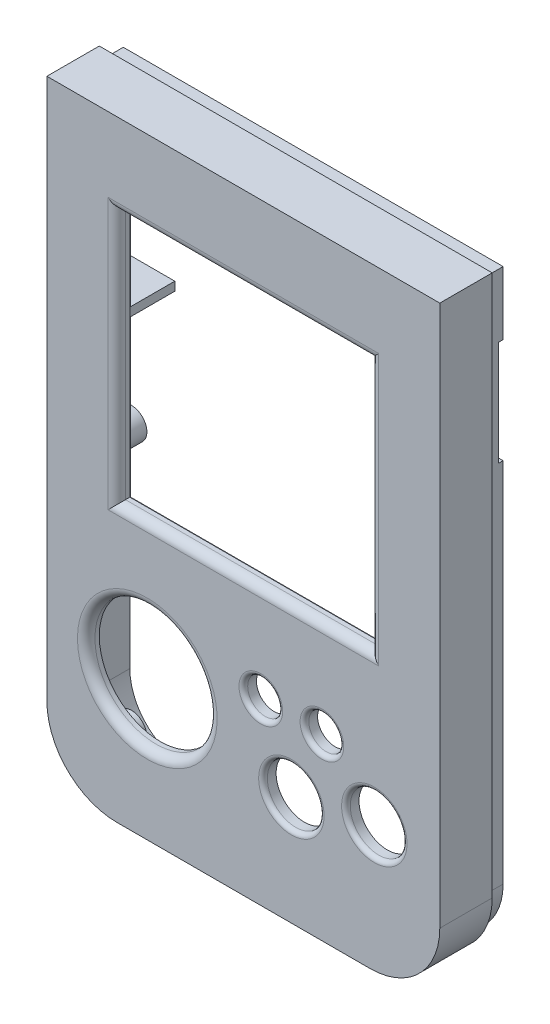
from build123d import *

# Parameters (mm, degrees)
EXTRUDE_1_DEPTH     = 8
SHELL_2_T           = -1.5
SKETCH_4_R          = 7
SKETCH_4_R_2        = 3.25
SKETCH_4_R_3        = 2
SKETCH_4_W          = 29
SKETCH_4_H          = 29
CUT_EXTRUDE_3_DEPTH = 84.600239234
FILLET_1_R          = 1
FILLET_2_R          = 1
FILLET_3_R          = 0.5
SKETCH_5_W          = 33.7
SKETCH_5_H          = 37.6
SKETCH_5_W_2        = 31.7
SKETCH_5_H_2        = 35.6
EXTRUDE_2_DEPTH     = 1.4
SKETCH_6_R          = 1.75
SKETCH_6_R_2        = 0.75
EXTRUDE_3_DEPTH     = 3.7
CUT_EXTRUDE_4_DEPTH = 2
SKETCH_8_W          = 0.75
SKETCH_8_H          = 12
CUT_EXTRUDE_5_DEPTH = 0.5
SKETCH_9_W          = 5.15
SKETCH_9_H          = 1
EXTRUDE_4_DEPTH     = 6.5


with BuildPart() as part:
    # 草图1 → 凸台-拉伸1 (new body)
    with BuildSketch(Plane.XY):
        with BuildLine():
            Line((-45, 70), (0, 70))
            Line((0, 70), (0, 8))
            ThreePointArc((0, 8), (-2.343145751, 2.343145751), (-8, 0))
            Line((-8, 0), (-37, 0))
            ThreePointArc((-37, 0), (-42.656854249, 2.343145751), (-45, 8))
            Line((-45, 8), (-45, 70))
        make_face()
    extrude(amount=EXTRUDE_1_DEPTH)

    # 抽壳2
    shell_2_openings = [part.faces().sort_by_distance(p)[0] for p in [
        (-22.5, 35.292176643, 0),
    ]]
    offset(amount=SHELL_2_T, openings=shell_2_openings, kind=Kind.INTERSECTION)

    # 草图4 → 切除-拉伸3 (cut, through all)
    with BuildSketch(Plane(origin=(0, 0, 0), x_dir=(-1, 0, 0), z_dir=(0, 0, -1))):
        with Locations((33.5, 16)):
            Circle(SKETCH_4_R)
        with Locations((7.5, 14.5)):
            Circle(SKETCH_4_R_2)
        with Locations((17, 12.5)):
            Circle(SKETCH_4_R_2)
        with Locations((13.5, 20.5)):
            Circle(SKETCH_4_R_3)
        with Locations((20.5, 20.5)):
            Circle(SKETCH_4_R_3)
        with Locations((22.5, 46)):
            Rectangle(SKETCH_4_W, SKETCH_4_H)
    extrude(amount=-CUT_EXTRUDE_3_DEPTH, mode=Mode.SUBTRACT)

    # 圆角1
    fillet_1_edges = [part.edges().sort_by_distance(p)[0] for p in [
        (-22.5, 60.5, 8),
        (-8, 46, 8),
        (-22.5, 31.5, 8),
        (-37, 46, 8),
    ]]
    fillet(fillet_1_edges, radius=FILLET_1_R)

    # 圆角2
    fillet_2_edges = [part.edges().sort_by_distance(p)[0] for p in [
        (-26.5, 16, 8),
    ]]
    fillet(fillet_2_edges, radius=FILLET_2_R)

    # 圆角3
    fillet_3_edges = [part.edges().sort_by_distance(p)[0] for p in [
        (-11.5, 20.5, 8),
        (-18.5, 20.5, 8),
        (-4.25, 14.5, 8),
        (-13.75, 12.5, 8),
    ]]
    fillet(fillet_3_edges, radius=FILLET_3_R)

    # 草图5 → 凸台-拉伸2 (add)
    with BuildSketch(Plane(origin=(0, 0, 6.5), x_dir=(-1, 0, 0), z_dir=(0, 0, -1))):
        with Locations((22.5, 47.95)):
            Rectangle(SKETCH_5_W, SKETCH_5_H)
        with Locations((22.5, 47.95)):
            Rectangle(SKETCH_5_W_2, SKETCH_5_H_2, mode=Mode.SUBTRACT)
    extrude(amount=EXTRUDE_2_DEPTH)

    # 草图6 → 凸台-拉伸3 (add)
    # profile 1 of 6: a face of its own
    with BuildSketch(Plane(origin=(0, 0, 6.5), x_dir=(-1, 0, 0), z_dir=(0, 0, -1))):
        with Locations((4.5, 65.5)):
            Circle(SKETCH_6_R)
        with Locations((4.5, 65.5)):
            Circle(SKETCH_6_R_2, mode=Mode.SUBTRACT)
    # profile 2 of 6: a face of its own
    with BuildSketch(Plane(origin=(0, 0, 6.5), x_dir=(-1, 0, 0), z_dir=(0, 0, -1))):
        with Locations((4.5, 35.25)):
            Circle(SKETCH_6_R)
        with Locations((4.5, 35.25)):
            Circle(SKETCH_6_R_2, mode=Mode.SUBTRACT)
    # profile 3 of 6: a face of its own
    with BuildSketch(Plane(origin=(0, 0, 6.5), x_dir=(-1, 0, 0), z_dir=(0, 0, -1))):
        with Locations((4.5, 5)):
            Circle(SKETCH_6_R)
        with Locations((4.5, 5)):
            Circle(SKETCH_6_R_2, mode=Mode.SUBTRACT)
    # profile 4 of 6: a face of its own
    with BuildSketch(Plane(origin=(0, 0, 6.5), x_dir=(-1, 0, 0), z_dir=(0, 0, -1))):
        with Locations((40.5, 5)):
            Circle(SKETCH_6_R)
        with Locations((40.5, 5)):
            Circle(SKETCH_6_R_2, mode=Mode.SUBTRACT)
    # profile 5 of 6: a face of its own
    with BuildSketch(Plane(origin=(0, 0, 6.5), x_dir=(-1, 0, 0), z_dir=(0, 0, -1))):
        with Locations((40.5, 35.25)):
            Circle(SKETCH_6_R)
        with Locations((40.5, 35.25)):
            Circle(SKETCH_6_R_2, mode=Mode.SUBTRACT)
    # profile 6 of 6: a face of its own
    with BuildSketch(Plane(origin=(0, 0, 6.5), x_dir=(-1, 0, 0), z_dir=(0, 0, -1))):
        with Locations((40.5, 65.5)):
            Circle(SKETCH_6_R)
        with Locations((40.5, 65.5)):
            Circle(SKETCH_6_R_2, mode=Mode.SUBTRACT)
    extrude(amount=EXTRUDE_3_DEPTH)

    # 草图7 → 切除-拉伸4 (cut)
    with BuildSketch(Plane(origin=(0, 0, 0), x_dir=(-1, 0, 0), z_dir=(0, 0, -1))):
        with BuildLine():
            Line((0, 70), (45, 70))
            Line((45, 70), (45, 8))
            ThreePointArc((45, 8), (42.656854249, 2.343145751), (37, 0))
            Line((37, 0), (8, 0))
            ThreePointArc((8, 0), (2.343145751, 2.343145751), (0, 8))
            Line((0, 8), (0, 70))
        make_face()
        with BuildLine():
            Line((0.75, 69.25), (44.25, 69.25))
            Line((44.25, 69.25), (44.25, 8))
            ThreePointArc((44.25, 8), (42.126524164, 2.873475836), (37, 0.75))
            Line((37, 0.75), (8, 0.75))
            ThreePointArc((8, 0.75), (2.873475836, 2.873475836), (0.75, 8))
            Line((0.75, 8), (0.75, 69.25))
        make_face(mode=Mode.SUBTRACT)
    extrude(amount=-CUT_EXTRUDE_4_DEPTH, mode=Mode.SUBTRACT)

    # 草图8 → 切除-拉伸5 (cut)
    with BuildSketch(Plane(origin=(0, 0, 0), x_dir=(-1, 0, 0), z_dir=(0, 0, -1))):
        with Locations((1.125, 56)):
            Rectangle(SKETCH_8_W, SKETCH_8_H)
    extrude(amount=-CUT_EXTRUDE_5_DEPTH, mode=Mode.SUBTRACT)

    # 草图9 → 凸台-拉伸4 (add)
    with BuildSketch(Plane(origin=(0, 0, 6.5), x_dir=(-1, 0, 0), z_dir=(0, 0, -1))):
        with Locations((40.925, 48.5)):
            Rectangle(SKETCH_9_W, SKETCH_9_H)
    extrude(amount=EXTRUDE_4_DEPTH)


solid = part.part
